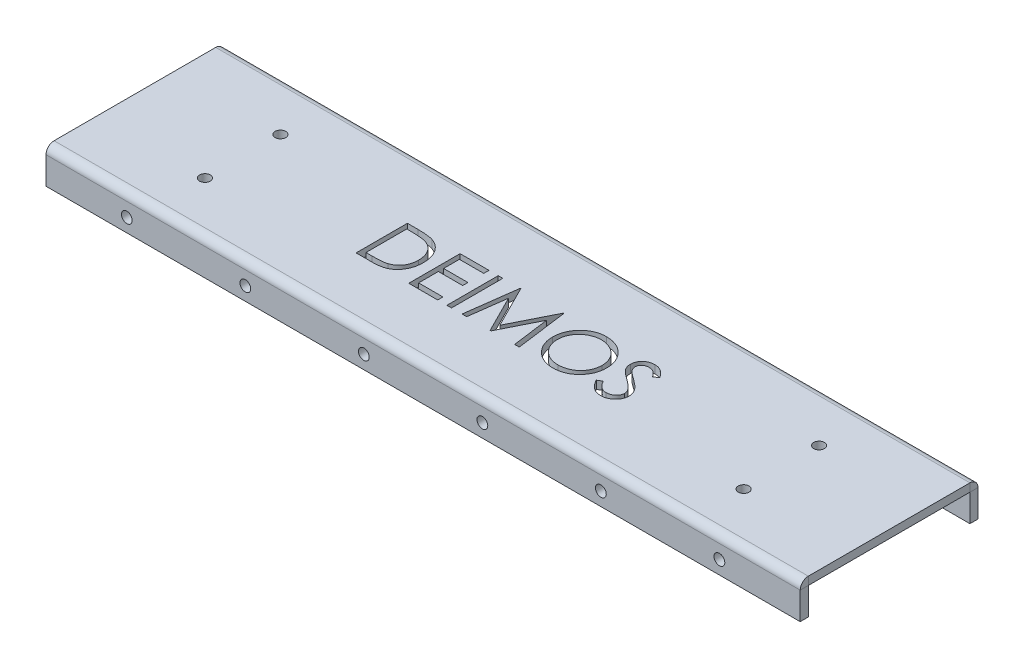
from build123d import *

# Parameters (mm, degrees)
SKETCH1_W                  = 280
SKETCH1_H                  = 85
BOSS_EXTRUDE1_DEPTH        = 3
SKETCH7_R                  = 2
CUT_EXTRUDE1_DEPTH         = 3
SKETCHED_BEND1_OUTLINE_W   = 280
SKETCHED_BEND1_OUTLINE_H   = 71.858097245
SKETCHED_BEND1_OUTLINE_R   = 2
SKETCHED_BEND1_DEPTH       = 3
SKETCHED_START             = 3
SKETCHED_BEND1_2_OUTLINE_W = 280
SKETCHED_BEND1_2_OUTLINE_H = 3
SKETCHED_BEND1_2_DEPTH     = 60.00380551
SKETCHED_START_2           = 63.00380551
SKETCHED_BEND1_3_OUTLINE_W = 280
SKETCHED_BEND1_3_OUTLINE_H = 10.141902755
SKETCHED_BEND1_3_OUTLINE_R = 2
SKETCHED_BEND1_3_DEPTH     = 3
SKETCHED_BEND1_4_DEPTH     = 280
SKETCHED_BEND1_5_DEPTH     = 280
SKETCH8_R                  = 2
SKETCH8_W                  = 1.709615384
SKETCH8_H                  = 19.05
CUT_EXTRUDE2_DEPTH         = 3


with BuildPart() as part:
    # Sketch1 → Boss-Extrude1 (new body)
    with BuildSketch(Plane.XY):
        with Locations((140, -42.5)):
            Rectangle(SKETCH1_W, SKETCH1_H)
    extrude(amount=BOSS_EXTRUDE1_DEPTH)

    # Sketch7 → Cut-Extrude1 (cut)
    with BuildSketch(Plane.XY.offset(3)):
        with Locations((30, -5)):
            Circle(SKETCH7_R)
        with Locations((74, -5)):
            Circle(SKETCH7_R)
        with Locations((118, -5)):
            Circle(SKETCH7_R)
        with Locations((162, -5)):
            Circle(SKETCH7_R)
        with Locations((206, -5)):
            Circle(SKETCH7_R)
        with Locations((250, -5)):
            Circle(SKETCH7_R)
        with Locations(Location((250, -80, 0), (0, 0, 180))):
            Circle(SKETCH7_R)
        with Locations(Location((206, -80, 0), (0, 0, 180))):
            Circle(SKETCH7_R)
        with Locations(Location((162, -80, 0), (0, 0, 180))):
            Circle(SKETCH7_R)
        with Locations(Location((118, -80, 0), (0, 0, 180))):
            Circle(SKETCH7_R)
        with Locations(Location((74, -80, 0), (0, 0, 180))):
            Circle(SKETCH7_R)
        with Locations(Location((30, -80, 0), (0, 0, 180))):
            Circle(SKETCH7_R)
    extrude(amount=-CUT_EXTRUDE1_DEPTH, mode=Mode.SUBTRACT)

    # Sketched Bend1: read off the stored shape, not the designer's step
    # Sketched Bend1 outline → Sketched Bend1 (cut)
    with BuildSketch(Plane.XY):
        with Locations((140, -35.929048623)):
            Rectangle(SKETCHED_BEND1_OUTLINE_W, SKETCHED_BEND1_OUTLINE_H)
        with Locations((30, -5)):
            Circle(SKETCHED_BEND1_OUTLINE_R, mode=Mode.SUBTRACT)
        with Locations((74, -5)):
            Circle(SKETCHED_BEND1_OUTLINE_R, mode=Mode.SUBTRACT)
        with Locations((118, -5)):
            Circle(SKETCHED_BEND1_OUTLINE_R, mode=Mode.SUBTRACT)
        with Locations((162, -5)):
            Circle(SKETCHED_BEND1_OUTLINE_R, mode=Mode.SUBTRACT)
        with Locations((206, -5)):
            Circle(SKETCHED_BEND1_OUTLINE_R, mode=Mode.SUBTRACT)
        with Locations((250, -5)):
            Circle(SKETCHED_BEND1_OUTLINE_R, mode=Mode.SUBTRACT)
    extrude(amount=SKETCHED_BEND1_DEPTH, mode=Mode.SUBTRACT)

    # Sketched Bend1 2 outline → Sketched Bend1 2 (add)
    with BuildSketch(Plane.XY.offset(SKETCHED_START)):
        with Locations((140, -73.358097245)):
            Rectangle(SKETCHED_BEND1_2_OUTLINE_W, SKETCHED_BEND1_2_OUTLINE_H)
    extrude(amount=SKETCHED_BEND1_2_DEPTH)

    # Sketched Bend1 3 outline → Sketched Bend1 3 (add)
    with BuildSketch(Plane.XY.offset(SKETCHED_START_2)):
        with Locations((140, -79.929048623)):
            Rectangle(SKETCHED_BEND1_3_OUTLINE_W, SKETCHED_BEND1_3_OUTLINE_H)
        with Locations((30, -80)):
            Circle(SKETCHED_BEND1_3_OUTLINE_R, mode=Mode.SUBTRACT)
        with Locations((74, -80)):
            Circle(SKETCHED_BEND1_3_OUTLINE_R, mode=Mode.SUBTRACT)
        with Locations((118, -80)):
            Circle(SKETCHED_BEND1_3_OUTLINE_R, mode=Mode.SUBTRACT)
        with Locations((162, -80)):
            Circle(SKETCHED_BEND1_3_OUTLINE_R, mode=Mode.SUBTRACT)
        with Locations((206, -80)):
            Circle(SKETCHED_BEND1_3_OUTLINE_R, mode=Mode.SUBTRACT)
        with Locations((250, -80)):
            Circle(SKETCHED_BEND1_3_OUTLINE_R, mode=Mode.SUBTRACT)
    extrude(amount=SKETCHED_BEND1_3_DEPTH)

    # Sketched Bend1 4 outline → Sketched Bend1 4 (cut)
    with BuildSketch(Plane.YZ):
        with BuildLine():
            Line((-71.858097245, 0), (-71.858097245, 3))
            ThreePointArc((-71.858097245, 3), (-72.736776901, 0.878679657), (-74.858097245, 0))
            Line((-74.858097245, 0), (-71.858097245, 0))
        make_face()
    extrude(amount=SKETCHED_BEND1_4_DEPTH, mode=Mode.SUBTRACT)

    # Sketched Bend1 5 outline → Sketched Bend1 5 (add)
    with BuildSketch(Plane.YZ):
        with BuildLine():
            ThreePointArc((-71.858097245, 63.00380551), (-72.736776902, 65.125125853), (-74.858097245, 66.00380551))
            Line((-74.858097245, 66.00380551), (-74.858097245, 63.00380551))
            Line((-74.858097245, 63.00380551), (-71.858097245, 63.00380551))
        make_face()
    extrude(amount=SKETCHED_BEND1_5_DEPTH)

    # Sketch8 → Cut-Extrude2 (cut)
    # profile 1 of 10: a face of its own
    with BuildSketch(Plane(origin=(0, -71.858097245, 0), x_dir=(1, 0, 0), z_dir=(0, 1, 0))):
        with Locations(Location((40, -19, 0), (0, 0, 270))):
            Circle(SKETCH8_R)
    # profile 2 of 10: a face of its own
    with BuildSketch(Plane(origin=(0, -71.858097245, 0), x_dir=(1, 0, 0), z_dir=(0, 1, 0))):
        with Locations(Location((240, -19, 0), (0, 0, 90))):
            Circle(SKETCH8_R)
    # profile 3 of 10: a face of its own
    with BuildSketch(Plane(origin=(0, -71.858097245, 0), x_dir=(1, 0, 0), z_dir=(0, 1, 0))):
        with Locations(Location((240, -47.00380551, 0), (0, 0, 270))):
            Circle(SKETCH8_R)
    # profile 4 of 10: a face of its own
    with BuildSketch(Plane(origin=(0, -71.858097245, 0), x_dir=(1, 0, 0), z_dir=(0, 1, 0))):
        with Locations(Location((40, -47.00380551, 0), (0, 0, 90))):
            Circle(SKETCH8_R)
    # profile 5 of 10: a face of its own
    with BuildSketch(Plane(origin=(0, -71.858097245, 0), x_dir=(1, 0, 0), z_dir=(0, 1, 0))):
        with BuildLine():
            Line((92.130769231, -43.00380551), (92.130769231, -23.95380551))
            Line((92.130769231, -23.95380551), (95.977403846, -23.95380551))
            add(Edge.make_bspline(
                [(95.977403846, -23.95380551), (96.311970768, -23.956214355), (96.958352319, -23.960868232), (97.892414354, -23.990376089), (98.75665169, -24.042575625), (99.548221966, -24.11860976), (100.269298277, -24.211971271), (100.917861558, -24.328994901), (101.497265365, -24.467179085), (101.853606177, -24.584992179), (102.022115385, -24.640704548)],
                knots=[0, 0, 0, 0, 1.314313732, 2.53924729, 3.670748893, 4.714932338, 5.66265055, 6.526160246, 7.303039223, 8, 8, 8, 8], degree=3))
            add(Edge.make_bspline(
                [(102.022115385, -24.640704548), (102.242522466, -24.724691675), (102.678338527, -24.890761378), (103.298863008, -25.204032104), (103.883019626, -25.558977701), (104.433940972, -25.956066039), (104.939042613, -26.406540564), (105.418057022, -26.891265559), (105.85138859, -27.427867811), (106.24821803, -28.005218817), (106.606007834, -28.616517272), (106.917008107, -29.260598364), (107.175293414, -29.934191168), (107.389705119, -30.635422473), (107.558686552, -31.365834187), (107.67397678, -32.126276801), (107.750018882, -32.91374496), (107.757660933, -33.448094541), (107.761538462, -33.719220173)],
                knots=[0, 0, 0, 0, 0.984719456, 1.947108742, 2.898477687, 3.838006223, 4.779231079, 5.722358779, 6.681677486, 7.655904652, 8.64651281, 9.637519902, 10.640069247, 11.656948941, 12.698408672, 13.768548281, 14.867775369, 16, 16, 16, 16], degree=3))
            add(Edge.make_bspline(
                [(107.761538462, -33.719220173), (107.758115081, -33.954684914), (107.751368953, -34.41869278), (107.690793677, -35.102538226), (107.602748278, -35.766096378), (107.466436287, -36.406207403), (107.300959749, -37.02847956), (107.08888344, -37.626280776), (106.845938811, -38.205094938), (106.562638758, -38.757095771), (106.251626362, -39.280063841), (105.917860874, -39.773053501), (105.561698289, -40.229030065), (105.179742344, -40.649374368), (104.776928916, -41.03345273), (104.350620774, -41.384473557), (103.899717884, -41.69556852), (103.426239807, -41.978962352), (102.916374018, -42.226178858), (102.360463089, -42.435347911), (101.756136249, -42.608684489), (101.104876855, -42.753306079), (100.40555964, -42.868026827), (99.657498983, -42.944914763), (98.861844221, -42.99691001), (98.31549422, -43.00146238), (98.034284856, -43.00380551)],
                knots=[0, 0, 0, 0, 1.105936401, 2.179363191, 3.223086493, 4.248585256, 5.251745608, 6.245858792, 7.225916811, 8.198733463, 9.158002045, 10.082870192, 10.993790845, 11.873723703, 12.748670949, 13.606408763, 14.465103618, 15.319838547, 16.196477973, 17.123216899, 18.106603292, 19.147568657, 20.255746949, 21.433717677, 22.679120308, 24, 24, 24, 24], degree=3))
            Line((98.034284856, -43.00380551), (92.130769231, -43.00380551))
        make_face()
        with BuildLine():
            Line((93.840384615, -41.049959356), (96.027013221, -41.049959356))
            add(Edge.make_bspline(
                [(96.027013221, -41.049959356), (96.341220496, -41.048609003), (96.945556156, -41.046011779), (97.814551827, -41.023221431), (98.608552542, -40.985981742), (99.327671043, -40.933865962), (99.971501304, -40.864912499), (100.541388857, -40.788032671), (101.03546562, -40.692252261), (101.334438698, -40.605433467), (101.472596154, -40.565313923)],
                knots=[0, 0, 0, 0, 1.375205317, 2.645023457, 3.804390687, 4.853969522, 5.800190428, 6.637939096, 7.370582563, 8, 8, 8, 8], degree=3))
            add(Edge.make_bspline(
                [(101.472596154, -40.565313923), (101.646486525, -40.504073299), (101.990113898, -40.383054782), (102.484766662, -40.162305226), (102.94608693, -39.900819103), (103.382114353, -39.610158155), (103.786663721, -39.28007063), (104.164529268, -38.917734248), (104.514950216, -38.521304972), (104.834306092, -38.091274836), (105.12010129, -37.630320377), (105.367594695, -37.142973296), (105.584500889, -36.634573372), (105.7547458, -36.097313523), (105.888180622, -35.53599679), (105.982694138, -34.950583687), (106.041557139, -34.341183538), (106.04842302, -33.926698405), (106.051923077, -33.715404068)],
                knots=[0, 0, 0, 0, 0.998632004, 1.973411704, 2.929992603, 3.868527914, 4.809262121, 5.754881198, 6.702106254, 7.672490631, 8.653608572, 9.636854334, 10.631411391, 11.644891563, 12.686317036, 13.754757253, 14.855430412, 16, 16, 16, 16], degree=3))
            add(Edge.make_bspline(
                [(106.051923077, -33.715404068), (106.049129327, -33.492608982), (106.043640981, -33.054926064), (105.97465652, -32.412719566), (105.873846339, -31.795060596), (105.728066562, -31.201907847), (105.542297065, -30.632104102), (105.310460515, -30.088800768), (105.045575058, -29.566259981), (104.730415468, -29.076542362), (104.385253452, -28.613392725), (104.002196709, -28.189095256), (103.587331042, -27.802683422), (103.145181362, -27.448139449), (102.663286579, -27.139727156), (102.152998633, -26.863846791), (101.60683148, -26.62971744), (101.22685095, -26.505191058), (101.03374399, -26.441906471)],
                knots=[0, 0, 0, 0, 1.122418816, 2.205001699, 3.251619955, 4.274784885, 5.280384055, 6.268708349, 7.249350384, 8.229342522, 9.199999885, 10.157847722, 11.105861043, 12.055065948, 13.010012805, 13.98527497, 14.976112212, 16, 16, 16, 16], degree=3))
            add(Edge.make_bspline(
                [(101.03374399, -26.441906471), (100.873989894, -26.397729914), (100.534308852, -26.303798432), (99.980011198, -26.201334619), (99.356177313, -26.110958703), (98.660037512, -26.034442803), (97.892385327, -25.979538954), (97.052630368, -25.93832937), (96.140409663, -25.910534699), (95.508044729, -25.908636735), (95.17983774, -25.907651664)],
                knots=[0, 0, 0, 0, 0.674548936, 1.434276114, 2.292660221, 3.240891867, 4.284742987, 5.42552168, 6.663806718, 8, 8, 8, 8], degree=3))
            Line((95.17983774, -25.907651664), (93.840384615, -25.907651664))
            Line((93.840384615, -25.907651664), (93.840384615, -41.049959356))
        make_face(mode=Mode.SUBTRACT)
    # profile 6 of 10: a face of its own
    with BuildSketch(Plane(origin=(0, -71.858097245, 0), x_dir=(1, 0, 0), z_dir=(0, 1, 0))):
        Polygon((111.669230769, -23.95380551), (122.415384615, -23.95380551), (122.415384615, -25.907651664), (113.378846154, -25.907651664), (113.378846154, -31.769190125), (122.415384615, -31.769190125), (122.415384615, -33.723036279), (113.378846154, -33.723036279), (113.378846154, -41.049959356), (122.415384615, -41.049959356), (122.415384615, -43.00380551), (111.669230769, -43.00380551), align=None)
    # profile 7 of 10: a face of its own
    with BuildSketch(Plane(origin=(0, -71.858097245, 0), x_dir=(1, 0, 0), z_dir=(0, 1, 0))):
        with Locations((126.689423077, -33.47880551)):
            Rectangle(SKETCH8_W, SKETCH8_H)
    # profile 8 of 10: a face of its own
    with BuildSketch(Plane(origin=(0, -71.858097245, 0), x_dir=(1, 0, 0), z_dir=(0, 1, 0))):
        Polygon((131.451923077, -43.00380551), (133.966736779, -23.95380551), (134.210967548, -23.95380551), (142.075961538, -39.584574741), (149.921875, -23.95380551), (150.169921875, -23.95380551), (152.7, -43.00380551), (150.982752404, -43.00380551), (149.158653846, -29.296353587), (142.28203125, -43.00380551), (141.896604567, -43.00380551), (134.993269231, -29.265824741), (133.172986779, -43.00380551), align=None)
    # profile 9 of 10: a face of its own
    with BuildSketch(Plane(origin=(0, -71.858097245, 0), x_dir=(1, 0, 0), z_dir=(0, 1, 0))):
        with BuildLine():
            add(Edge.make_bspline(
                [(165.522115385, -23.465343971), (165.874856647, -23.474278309), (166.567669588, -23.491826085), (167.585891532, -23.626150921), (168.557959122, -23.858535829), (169.491790877, -24.168032919), (170.376216935, -24.580897502), (171.217894336, -25.079926667), (172.014820463, -25.670348535), (172.756253983, -26.347599041), (173.434743955, -27.084471841), (174.032510565, -27.870844465), (174.533483621, -28.701962232), (174.944886262, -29.57532761), (175.267640124, -30.488965436), (175.490356633, -31.447746508), (175.63262285, -32.445458636), (175.64925501, -33.125961999), (175.657692308, -33.471173298)],
                knots=[0, 0, 0, 0, 1.065120563, 2.091984664, 3.0946048, 4.079830382, 5.057816894, 6.036188127, 7.030412546, 8.04752943, 9.064399622, 10.05169764, 11.02544977, 11.989514704, 12.962713494, 13.945757189, 14.957906945, 16, 16, 16, 16], degree=3))
            add(Edge.make_bspline(
                [(175.657692308, -33.471173298), (175.649256246, -33.813841685), (175.632627792, -34.489280773), (175.490194874, -35.480661519), (175.266814575, -36.433655167), (174.947883469, -37.346670792), (174.538441936, -38.220671532), (174.034133076, -39.053357666), (173.440093057, -39.845002179), (172.764052911, -40.586932543), (172.027084382, -41.267275919), (171.236616787, -41.860105799), (170.410427432, -42.37023282), (169.537884592, -42.777269674), (168.630560106, -43.102599698), (167.680333461, -43.324410442), (166.691657217, -43.467487063), (166.017445039, -43.483916414), (165.674759615, -43.492267048)],
                knots=[0, 0, 0, 0, 1.043624062, 2.057103931, 3.04512605, 4.022047818, 4.998200453, 5.980619268, 6.982898556, 8.009068085, 9.034988726, 10.034168286, 11.015286542, 11.987931943, 12.962482838, 13.94673481, 14.956375938, 16, 16, 16, 16], degree=3))
            add(Edge.make_bspline(
                [(165.674759615, -43.492267048), (165.329550108, -43.483833957), (164.649050275, -43.467210089), (163.650084411, -43.324708443), (162.690629834, -43.101870775), (161.773430294, -42.783412272), (160.89797432, -42.371838488), (160.062549727, -41.869983225), (159.270509797, -41.274495785), (158.528421148, -40.598674858), (157.849429084, -39.86295541), (157.257467339, -39.07464325), (156.755499222, -38.249204265), (156.34530737, -37.384347741), (156.020562241, -36.484254603), (155.799011731, -35.542920747), (155.655668906, -34.565712865), (155.63915067, -33.900362233), (155.630769231, -33.562759837)],
                knots=[0, 0, 0, 0, 1.053102029, 2.075944431, 3.073151272, 4.055350789, 5.033113405, 6.020478099, 7.024410459, 8.052272461, 9.079885166, 10.07527673, 11.055994387, 12.023226415, 12.992069828, 13.970394897, 14.97016774, 16, 16, 16, 16], degree=3))
            add(Edge.make_bspline(
                [(155.630769231, -33.562759837), (155.633679175, -33.336159166), (155.639462355, -32.885816494), (155.709085709, -32.217071142), (155.810114397, -31.559080562), (155.954904807, -30.91371583), (156.14427088, -30.282556757), (156.367711201, -29.661250462), (156.640615216, -29.056093337), (156.949119886, -28.46421859), (157.29344487, -27.894852703), (157.673768592, -27.356665258), (158.076732526, -26.845140118), (158.518493283, -26.373532854), (158.984491363, -25.928123953), (159.48228625, -25.515758307), (160.008840465, -25.132717503), (160.566419704, -24.787529646), (161.141284886, -24.475332071), (161.733885633, -24.207424568), (162.336173544, -23.97748529), (162.950969556, -23.79111737), (163.576641073, -23.64398586), (164.214553643, -23.543797263), (164.864199063, -23.473996333), (165.301866385, -23.468240501), (165.522115385, -23.465343971)],
                knots=[0, 0, 0, 0, 1.037015668, 2.060948919, 3.074880161, 4.083647147, 5.086022904, 6.090072063, 7.104153813, 8.122640571, 9.144368836, 10.147691507, 11.138137339, 12.123020368, 13.103399296, 14.087645067, 15.080126199, 16.082011238, 17.087798457, 18.072939717, 19.057185487, 20.037253025, 21.01195951, 21.997135196, 22.992090687, 24, 24, 24, 24], degree=3))
        make_face()
        with BuildLine():
            add(Edge.make_bspline(
                [(165.606069712, -25.419190125), (165.425287206, -25.421393885), (165.065450488, -25.425780337), (164.530501798, -25.48356016), (164.002588558, -25.565909984), (163.481601744, -25.683375119), (162.969721226, -25.843417177), (162.462175662, -26.027608406), (161.963593326, -26.251968913), (161.475620185, -26.50545749), (161.002553848, -26.786030902), (160.55617043, -27.096120091), (160.135314325, -27.428453079), (159.741015974, -27.783805451), (159.374433165, -28.163986855), (159.028350719, -28.563233686), (158.716640567, -28.99295755), (158.43096907, -29.441505622), (158.175329825, -29.908293657), (157.948006966, -30.388407336), (157.762057147, -30.885763031), (157.610406213, -31.394964946), (157.484677243, -31.915206619), (157.405026884, -32.450434596), (157.346612185, -32.99795942), (157.342476455, -33.36797494), (157.340384615, -33.555127625)],
                knots=[0, 0, 0, 0, 1.008559885, 2.007477868, 2.99961109, 3.989939068, 4.984837346, 5.991145699, 7.001802488, 8.033829008, 9.059044045, 10.069351652, 11.065060232, 12.050310815, 13.029377138, 14.011219647, 14.996725999, 15.989392538, 16.977580475, 17.965360261, 18.951710183, 19.937753436, 20.929683414, 21.935841486, 22.955955122, 24, 24, 24, 24], degree=3))
            add(Edge.make_bspline(
                [(157.340384615, -33.555127625), (157.347323507, -33.83033057), (157.360974453, -34.371739899), (157.48048637, -35.165135082), (157.664574546, -35.927615612), (157.935941069, -36.655009433), (158.275306557, -37.353569029), (158.694552917, -38.017097427), (159.191263083, -38.645773958), (159.755488849, -39.235209636), (160.372288152, -39.773213228), (161.027242011, -40.245454066), (161.713333789, -40.645015569), (162.432352649, -40.970526034), (163.180459969, -41.228461607), (163.962476354, -41.405238157), (164.773192426, -41.521581707), (165.325809278, -41.532754564), (165.606069712, -41.538420894)],
                knots=[0, 0, 0, 0, 1.032063989, 2.030389145, 3.003944642, 3.970395727, 4.937377036, 5.913328081, 6.909231446, 7.93887556, 8.970685674, 9.976071282, 10.964166581, 11.944589148, 12.933237628, 13.927779006, 14.949070134, 16, 16, 16, 16], degree=3))
            add(Edge.make_bspline(
                [(165.606069712, -41.538420894), (165.794444285, -41.535832792), (166.16804764, -41.530699808), (166.723738983, -41.478999867), (167.269419221, -41.396094978), (167.804322973, -41.276729552), (168.327843161, -41.127338328), (168.842164875, -40.949859123), (169.341809855, -40.728437143), (169.833081258, -40.483791864), (170.303323659, -40.204899007), (170.752226199, -39.905334221), (171.168474032, -39.573490728), (171.562477407, -39.223418062), (171.930565257, -38.848057691), (172.270248442, -38.447897626), (172.580383162, -38.020412049), (172.865946181, -37.57254434), (173.120689654, -37.104479022), (173.342644464, -36.622624632), (173.530946181, -36.12816768), (173.682957043, -35.620394984), (173.802076484, -35.100270935), (173.884154334, -34.56709911), (173.941567979, -34.021946117), (173.94589547, -33.653225987), (173.948076923, -33.467357193)],
                knots=[0, 0, 0, 0, 1.047197238, 2.076906641, 3.100256066, 4.114471768, 5.12198147, 6.126382909, 7.136867548, 8.15857795, 9.17633901, 10.174870724, 11.156907918, 12.133735059, 13.104061851, 14.077631395, 15.04955518, 16.038496417, 17.029181396, 18.010275684, 18.986308667, 19.968651475, 20.955262928, 21.950658345, 22.966943676, 24, 24, 24, 24], degree=3))
            add(Edge.make_bspline(
                [(173.948076923, -33.467357193), (173.945893722, -33.282759948), (173.941562942, -32.916577309), (173.884181759, -32.375226283), (173.801989769, -31.845890947), (173.683538459, -31.33064939), (173.530865479, -30.829370275), (173.342611581, -30.342524406), (173.120623022, -29.868298087), (172.865852544, -29.407863413), (172.579472133, -28.966040911), (172.26653918, -28.543662065), (171.921650642, -28.148659002), (171.554660421, -27.771280167), (171.156401746, -27.419574225), (170.728678659, -27.093424506), (170.276683784, -26.78495997), (169.798108403, -26.50669084), (169.304202026, -26.249710517), (168.797396055, -26.029541485), (168.283431956, -25.84245895), (167.763616716, -25.682890897), (167.233575077, -25.566370047), (166.696888522, -25.483485947), (166.154299572, -25.425800447), (165.789392905, -25.421400558), (165.606069712, -25.419190125)],
                knots=[0, 0, 0, 0, 1.02996197, 2.043119294, 3.035359645, 4.018872909, 4.991431989, 5.957985074, 6.929999688, 7.912076566, 8.892894881, 9.867085534, 10.843653904, 11.817741046, 12.803660682, 13.806313499, 14.818574707, 15.856120519, 16.894564902, 17.924820532, 18.937903209, 19.946497019, 20.957711757, 21.963978472, 22.977135795, 24, 24, 24, 24], degree=3))
        make_face(mode=Mode.SUBTRACT)
    # profile 10 of 10: a face of its own
    with BuildSketch(Plane(origin=(0, -71.858097245, 0), x_dir=(1, 0, 0), z_dir=(0, 1, 0))):
        with BuildLine():
            Line((177.611538462, -39.328895654), (179.221935096, -38.363420894))
            add(Edge.make_bspline(
                [(179.221935096, -38.363420894), (179.37171293, -38.614142761), (179.658681481, -39.094516182), (180.137388164, -39.743620659), (180.63341158, -40.295320398), (181.150424953, -40.746405933), (181.685272471, -41.101546303), (182.241445677, -41.35301845), (182.817070333, -41.509859687), (183.208813561, -41.528910158), (183.404387019, -41.538420894)],
                knots=[0, 0, 0, 0, 1.272034388, 2.437168799, 3.508375237, 4.49857839, 5.41946034, 6.295179144, 7.148887113, 8, 8, 8, 8], degree=3))
            add(Edge.make_bspline(
                [(183.404387019, -41.538420894), (183.571411217, -41.533769034), (183.902537082, -41.52454671), (184.390011576, -41.43593263), (184.863441099, -41.299795186), (185.313068113, -41.104826973), (185.73268853, -40.868941786), (186.100662114, -40.58402902), (186.418775959, -40.265043815), (186.67899414, -39.909175366), (186.878638332, -39.526449171), (187.032083733, -39.133605779), (187.117237633, -38.724474), (187.130065106, -38.449008481), (187.136538462, -38.309995414)],
                knots=[0, 0, 0, 0, 1.095163259, 2.171163733, 3.241058638, 4.321873601, 5.38011039, 6.391990106, 7.366004449, 8.327778327, 9.272591725, 10.192022065, 11.087607919, 12, 12, 12, 12], degree=3))
            add(Edge.make_bspline(
                [(187.136538462, -38.309995414), (187.128513999, -38.151385932), (187.112201439, -37.828956032), (186.974325812, -37.353252207), (186.757432054, -36.882485504), (186.557338236, -36.591285759), (186.453455529, -36.440103587)],
                knots=[0, 0, 0, 0, 0.938893495, 1.908633276, 2.914225137, 4, 4, 4, 4], degree=3))
            add(Edge.make_bspline(
                [(186.453455529, -36.440103587), (186.368162615, -36.33099159), (186.18910081, -36.1019246), (185.881266348, -35.760955533), (185.520045069, -35.40924671), (185.117798577, -35.033368128), (184.659874194, -34.650801692), (184.160614437, -34.243304351), (183.607272576, -33.82637291), (183.219199602, -33.546759375), (183.018960337, -33.402483394)],
                knots=[0, 0, 0, 0, 0.722233717, 1.516239348, 2.393582979, 3.351407094, 4.387010283, 5.505090956, 6.712668013, 8, 8, 8, 8], degree=3))
            add(Edge.make_bspline(
                [(183.018960337, -33.402483394), (182.818532586, -33.259724939), (182.435329989, -32.986781643), (181.899433991, -32.581700897), (181.420220557, -32.211347836), (180.999819624, -31.872235999), (180.638416104, -31.564319393), (180.33316211, -31.290554895), (180.091833677, -31.043538657), (179.957636874, -30.88329364), (179.897385817, -30.811347577)],
                knots=[0, 0, 0, 0, 1.452282411, 2.77665338, 3.964542531, 5.026858415, 5.96415736, 6.766646006, 7.446254459, 8, 8, 8, 8], degree=3))
            add(Edge.make_bspline(
                [(179.897385817, -30.811347577), (179.813170964, -30.699219077), (179.647551153, -30.478703332), (179.428933323, -30.134035177), (179.243118737, -29.781211404), (179.097455186, -29.419283913), (178.974793767, -29.0533338), (178.892291315, -28.678586305), (178.840630998, -28.296722968), (178.835340614, -28.039746629), (178.832692308, -27.911107193)],
                knots=[0, 0, 0, 0, 1.068054152, 2.10047183, 3.106115577, 4.101338837, 5.06977816, 6.043150881, 7.020423561, 8, 8, 8, 8], degree=3))
            add(Edge.make_bspline(
                [(178.832692308, -27.911107193), (178.839796374, -27.70955942), (178.853852662, -27.310771815), (178.972727477, -26.728218295), (179.160358512, -26.172032225), (179.423220688, -25.64771998), (179.762078566, -25.168933712), (180.154214512, -24.730166019), (180.621274173, -24.361311307), (181.133733451, -24.039028532), (181.694654562, -23.786774282), (182.282433622, -23.596486661), (182.898004828, -23.488667702), (183.314944746, -23.473194938), (183.526502404, -23.465343971)],
                knots=[0, 0, 0, 0, 1.005424448, 1.989358655, 2.955360095, 3.929531133, 4.905563448, 5.876582895, 6.856512386, 7.866279853, 8.892233794, 9.918561126, 10.94386622, 12, 12, 12, 12], degree=3))
            add(Edge.make_bspline(
                [(183.526502404, -23.465343971), (183.75098815, -23.473086716), (184.19741865, -23.488484565), (184.854095095, -23.622365414), (185.48634128, -23.843893357), (185.994939621, -24.095291624), (186.392990794, -24.346378329), (186.696553811, -24.57508623), (187.004170221, -24.838385035), (187.318321348, -25.136976075), (187.63368408, -25.473599105), (187.954940299, -25.845948712), (188.282841248, -26.251749395), (188.493783858, -26.541442749), (188.601923077, -26.689953346)],
                knots=[0, 0, 0, 0, 1.286793592, 2.559021753, 3.825965368, 5.121522368, 5.803751409, 6.523245864, 7.299691795, 8.125521123, 9.008227632, 9.944561021, 10.946284179, 12, 12, 12, 12], degree=3))
            Line((188.601923077, -26.689953346), (187.05640024, -27.861497818))
            add(Edge.make_bspline(
                [(187.05640024, -27.861497818), (186.963077379, -27.741272231), (186.783359369, -27.509745861), (186.510511733, -27.185507701), (186.253344092, -26.889326576), (185.999976916, -26.632069237), (185.763791579, -26.399647625), (185.534554535, -26.200658092), (185.315564709, -26.033150922), (185.03951981, -25.854388117), (184.692713371, -25.677187719), (184.257368967, -25.527242023), (183.802420813, -25.437135186), (183.492560961, -25.425221384), (183.335697115, -25.419190125)],
                knots=[0, 0, 0, 0, 1.181633172, 2.275549214, 3.290209073, 4.226197932, 5.078386478, 5.862611352, 6.581680152, 7.217281963, 8.414376989, 9.595101626, 10.782541182, 12, 12, 12, 12], degree=3))
            add(Edge.make_bspline(
                [(183.335697115, -25.419190125), (183.138902329, -25.425785235), (182.759402123, -25.438503283), (182.220612409, -25.577404917), (181.735686902, -25.796109042), (181.319022227, -26.102623423), (180.972110966, -26.465776255), (180.721165541, -26.883672595), (180.570125359, -27.3451311), (180.551694323, -27.667030687), (180.542307692, -27.830968971)],
                knots=[0, 0, 0, 0, 1.14458467, 2.207223713, 3.21896685, 4.227309161, 5.202851033, 6.127160689, 7.046193047, 8, 8, 8, 8], degree=3))
            add(Edge.make_bspline(
                [(180.542307692, -27.830968971), (180.544447424, -27.93303059), (180.548730388, -28.137320719), (180.608464644, -28.439134887), (180.685205277, -28.740186606), (180.80681303, -29.039122378), (180.974699611, -29.341170247), (181.195163497, -29.651531418), (181.472821667, -29.972941433), (181.685512262, -30.181987281), (181.79780649, -30.292357193)],
                knots=[0, 0, 0, 0, 0.858281714, 1.717966888, 2.583508476, 3.4729293, 4.427298488, 5.488583878, 6.674047936, 8, 8, 8, 8], degree=3))
            add(Edge.make_bspline(
                [(181.79780649, -30.292357193), (181.839506246, -30.329570147), (181.93857532, -30.41797961), (182.11969143, -30.562717594), (182.358865803, -30.741258398), (182.649852927, -30.962169363), (182.998018138, -31.218427036), (183.403399723, -31.506754839), (183.861478923, -31.836512837), (184.186536779, -32.06705888), (184.358413462, -32.18896176)],
                knots=[0, 0, 0, 0, 0.420754252, 0.999615792, 1.744751191, 2.668019286, 3.750313428, 4.999500688, 6.413464383, 8, 8, 8, 8], degree=3))
            add(Edge.make_bspline(
                [(184.358413462, -32.18896176), (184.565165361, -32.339409731), (184.965511759, -32.630731376), (185.535148016, -33.068422434), (186.051641457, -33.496491003), (186.516805465, -33.912203407), (186.935235495, -34.312406314), (187.302289375, -34.701914481), (187.621707149, -35.077937384), (187.96558261, -35.56002526), (188.316961599, -36.152105161), (188.618721804, -36.877519574), (188.808995095, -37.605753833), (188.8338772, -38.095212757), (188.846153846, -38.336708154)],
                knots=[0, 0, 0, 0, 1.163667725, 2.253281268, 3.268753668, 4.215851969, 5.092017293, 5.902905408, 6.650798638, 7.335211899, 8.59617414, 9.77448103, 10.901945474, 12, 12, 12, 12], degree=3))
            add(Edge.make_bspline(
                [(188.846153846, -38.336708154), (188.842577137, -38.507496113), (188.835493177, -38.845755443), (188.75406306, -39.34244379), (188.634757454, -39.824848952), (188.454940509, -40.287008007), (188.235467319, -40.73737593), (187.956976742, -41.164138931), (187.634173486, -41.576742329), (187.263875423, -41.964183903), (186.858677012, -42.319853912), (186.430412902, -42.63624209), (185.978382131, -42.90004825), (185.505036893, -43.115317833), (185.01026846, -43.28368455), (184.494243237, -43.405674595), (183.956110612, -43.480544964), (183.59034799, -43.488316066), (183.404387019, -43.492267048)],
                knots=[0, 0, 0, 0, 0.983748083, 1.948392443, 2.894712957, 3.844097841, 4.80183111, 5.778335162, 6.776009319, 7.81870978, 8.863265674, 9.881300176, 10.883814829, 11.87499822, 12.874611388, 13.892143829, 14.928324115, 16, 16, 16, 16], degree=3))
            add(Edge.make_bspline(
                [(183.404387019, -43.492267048), (183.260503224, -43.48948476), (182.974547701, -43.483955223), (182.551586093, -43.435071397), (182.137169186, -43.365908447), (181.736497165, -43.256103866), (181.344407825, -43.122879177), (180.962606448, -42.958840538), (180.590907998, -42.76225977), (180.22722944, -42.537496851), (179.872495718, -42.275925412), (179.530034043, -41.971269667), (179.188608047, -41.63193199), (178.858295219, -41.248697352), (178.532414247, -40.827757216), (178.217390333, -40.365173232), (177.906702698, -39.863465064), (177.711764223, -39.510413668), (177.611538462, -39.328895654)],
                knots=[0, 0, 0, 0, 0.915332311, 1.819136955, 2.706846663, 3.586547465, 4.459518054, 5.340707479, 6.227863349, 7.133153174, 8.059268498, 9.028702269, 10.047606654, 11.120612155, 12.245963614, 13.433783089, 14.680604001, 16, 16, 16, 16], degree=3))
        make_face()
    extrude(amount=-CUT_EXTRUDE2_DEPTH, mode=Mode.SUBTRACT)


with BuildPart() as cut_extrude2_piece_1:
    # of the separate pieces the step leaves, piece 1, a body of its own (cut_extrude2_pieces)
    add(part.part.solids().sort_by_distance((0, -85, 0))[0])


with BuildPart() as cut_extrude2_piece_2:
    # of the separate pieces the step leaves, piece 2, a body of its own (cut_extrude2_pieces)
    add(part.part.solids().sort_by_distance((173.948076923, -74.858097245, 33.467357192))[0])


with BuildPart() as cut_extrude2_piece_3:
    # of the separate pieces the step leaves, piece 3, a body of its own (cut_extrude2_pieces)
    add(part.part.solids().sort_by_distance((93.840384615, -74.858097245, 25.907651664))[0])


solid = Compound([cut_extrude2_piece_1.part, cut_extrude2_piece_2.part, cut_extrude2_piece_3.part])
